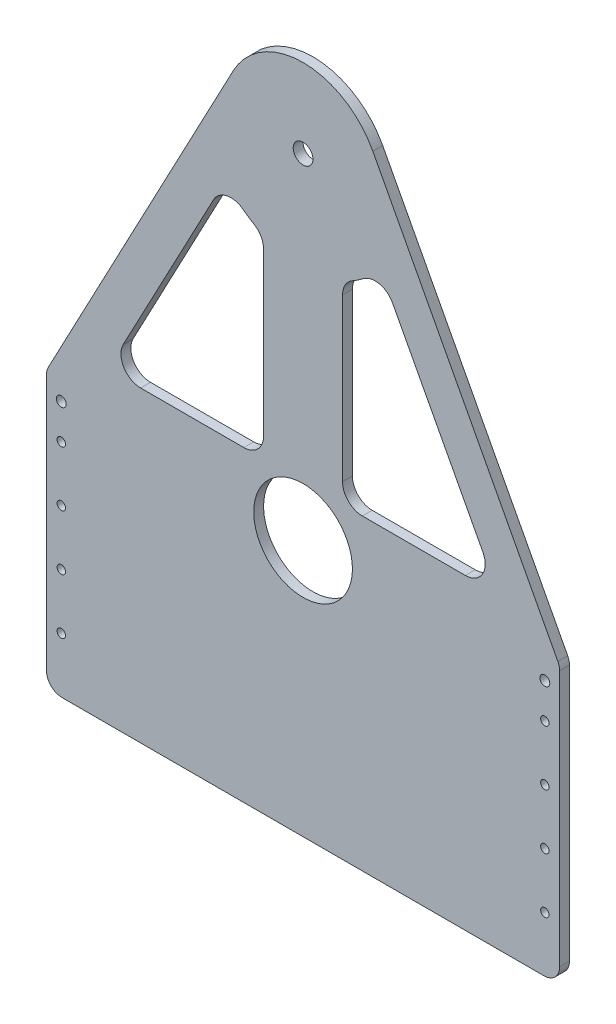
from build123d import *

# Parameters (mm, degrees)
AM_1014_TI_PLATE_BOTTOM_1_AM_0001_ARTEME_START = -3.175
AM_1014_TI_PLATE_BOTTOM_1_AM_0001_AR_2_R       = 1.352550752
AM_1014_TI_PLATE_BOTTOM_1_AM_0001_AR_2_R_2     = 1.5875
AM_1014_TI_PLATE_BOTTOM_1_AM_0001_AR_2_R_3     = 3.175
AM_1014_TI_PLATE_BOTTOM_1_AM_0001_ARTEME_DEPTH = 3.175
BOSS_EXTRUDE1_DEPTH                            = 3.175
FILLET1_R                                      = 5
FILLET2_R                                      = 5
SKETCH3_R                                      = 15.875
CUT_EXTRUDE1_DEPTH                             = 215.437164916


# Read off the part's stored shape, not the designer's step: AM_1014_TI_PLATE_BOTTOM<1>@AM_0001_ARTEMECH
with BuildPart() as part:
    # AM_1014_TI_PLATE_BOTTOM_1_AM_0001_AR 2 → AM_1014_TI_PLATE_BOTTOM<1>@AM_0001_ARTEMECH (new body)
    with BuildSketch(Plane.XY.offset(AM_1014_TI_PLATE_BOTTOM_1_AM_0001_ARTEME_START)):
        with BuildLine():
            Line((82.55, -17.865698052), (82.55, 70.885609673))
            Line((82.55, 70.885609673), (22.446426721, 184.373331383))
            ThreePointArc((22.446426721, 184.373331383), (0, 197.885609673), (-22.446426721, 184.373331383))
            Line((-22.446426721, 184.373331383), (-82.55, 70.885609673))
            Line((-82.55, 70.885609673), (-82.55, -17.865526365))
            Line((-82.55, -17.865526365), (82.55, -17.865698052))
        make_face()
        with BuildLine():
            add(Edge.make_bspline(
                [(-76.43495, -0.065424583), (-76.43495, -2.408108601), (-78.463775, -1.236766592), (-80.4926, -0.065424583), (-78.463775, 1.105917426), (-76.43495, 2.277259435), (-76.43495, -0.065424583)],
                knots=[0, 0, 0, 2.094395102, 2.094395102, 4.188790205, 4.188790205, 6.283185307, 6.283185307, 6.283185307], degree=2, weights=[1, 0.5, 1, 0.5, 1, 0.5, 1]))
        make_face(mode=Mode.SUBTRACT)
        with Locations((-77.7875, 17.727628115)):
            Circle(AM_1014_TI_PLATE_BOTTOM_1_AM_0001_AR_2_R, mode=Mode.SUBTRACT)
        with Locations((-77.7875, 35.507637995)):
            Circle(AM_1014_TI_PLATE_BOTTOM_1_AM_0001_AR_2_R, mode=Mode.SUBTRACT)
        with BuildLine():
            add(Edge.make_bspline(
                [(-76.43495, 53.274545779), (-76.43495, 50.931861761), (-78.463775, 52.10320377), (-80.4926, 53.274545779), (-78.463775, 54.445887788), (-76.43495, 55.617229797), (-76.43495, 53.274545779)],
                knots=[0, 0, 0, 2.094395102, 2.094395102, 4.188790205, 4.188790205, 6.283185307, 6.283185307, 6.283185307], degree=2, weights=[1, 0.5, 1, 0.5, 1, 0.5, 1]))
        make_face(mode=Mode.SUBTRACT)
        with Locations((-77.7875, 64.535609673)):
            Circle(AM_1014_TI_PLATE_BOTTOM_1_AM_0001_AR_2_R_2, mode=Mode.SUBTRACT)
        with BuildLine():
            Line((-25.498963051, 42.455971326), (-25.498963051, 51.980966033))
            add(Edge.make_bspline(
                [(-27.992064204, 57.025448466), (-25.498963051, 55.119281003), (-25.498963051, 51.980966033)],
                knots=[5.365154464, 5.365154464, 5.365154464, 6.283185307, 6.283185307, 6.283185307], degree=2, weights=[1, 0.896489165, 1]))
            ThreePointArc((-27.992064204, 57.025448466), (-26.013795844, 54.758623994), (-25.301036949, 51.835609673))
            Line((-25.301036949, 51.835609673), (-25.301036949, 42.310609673))
            ThreePointArc((-25.301036949, 42.310609673), (-24.985888452, 40.931525054), (-24.103005841, 39.826214575))
            add(Edge.make_bspline(
                [(-25.498963051, 42.455971326), (-25.49896305, 40.770584495), (-24.103005841, 39.826214575)],
                knots=[0, 0, 0, 0.976013915, 0.976013915, 0.976013915], degree=2, weights=[1, 0.883269083, 1]))
        make_face(mode=Mode.SUBTRACT)
        with Locations((-21.166666667, 47.762966307)):
            Circle(AM_1014_TI_PLATE_BOTTOM_1_AM_0001_AR_2_R_2, mode=Mode.SUBTRACT)
        with BuildLine():
            ThreePointArc((-11.2, 77.174125728), (-9.5, 78.874125728), (-7.8, 77.174125728))
            Line((-7.8, 77.174125728), (-7.8, 64.474125728))
            ThreePointArc((-7.8, 64.474125728), (-9.5, 62.774125728), (-11.2, 64.474125728))
            Line((-11.2, 64.474125728), (-11.2, 77.174125728))
        make_face(mode=Mode.SUBTRACT)
        with BuildLine():
            ThreePointArc((-1.7, 85.174125728), (0, 86.874125728), (1.7, 85.174125728))
            Line((1.7, 85.174125728), (1.7, 56.474125728))
            ThreePointArc((1.7, 56.474125728), (0, 54.774125728), (-1.7, 56.474125728))
            Line((-1.7, 56.474125728), (-1.7, 85.174125728))
        make_face(mode=Mode.SUBTRACT)
        with BuildLine():
            add(Edge.make_bspline(
                [(79.14005, -0.065596271), (79.14005, -2.408280289), (77.111225, -1.23693828), (75.0824, -0.065596271), (77.111225, 1.105745738), (79.14005, 2.277087747), (79.14005, -0.065596271)],
                knots=[0, 0, 0, 2.094395102, 2.094395102, 4.188790205, 4.188790205, 6.283185307, 6.283185307, 6.283185307], degree=2, weights=[1, 0.5, 1, 0.5, 1, 0.5, 1]))
        make_face(mode=Mode.SUBTRACT)
        with Locations((77.7875, 17.727456427)):
            Circle(AM_1014_TI_PLATE_BOTTOM_1_AM_0001_AR_2_R, mode=Mode.SUBTRACT)
        with Locations((77.7875, 35.507466307)):
            Circle(AM_1014_TI_PLATE_BOTTOM_1_AM_0001_AR_2_R, mode=Mode.SUBTRACT)
        with Locations((21.166666667, 47.762966307)):
            Circle(AM_1014_TI_PLATE_BOTTOM_1_AM_0001_AR_2_R_2, mode=Mode.SUBTRACT)
        with BuildLine():
            ThreePointArc((7.8, 77.174125728), (9.5, 78.874125728), (11.2, 77.174125728))
            Line((11.2, 77.174125728), (11.2, 64.474125728))
            ThreePointArc((11.2, 64.474125728), (9.5, 62.774125728), (7.8, 64.474125728))
            Line((7.8, 64.474125728), (7.8, 77.174125728))
        make_face(mode=Mode.SUBTRACT)
        with Locations((77.7875, 53.287476186)):
            Circle(AM_1014_TI_PLATE_BOTTOM_1_AM_0001_AR_2_R, mode=Mode.SUBTRACT)
        with Locations((77.7875, 64.535609673)):
            Circle(AM_1014_TI_PLATE_BOTTOM_1_AM_0001_AR_2_R_2, mode=Mode.SUBTRACT)
        with BuildLine():
            ThreePointArc((-28.80539088, 145.230757697), (-24.546211379, 148.463135508), (-19.3281535, 147.296624336))
            ThreePointArc((-19.3281535, 147.296624336), (-17.639343437, 146.086441824), (-15.875, 144.989303103))
            ThreePointArc((-15.875, 144.989303103), (-13.550738686, 142.665041789), (-12.7, 139.490041789))
            Line((-12.7, 139.490041789), (-12.7, 87.395609673))
            ThreePointArc((-12.7, 87.395609673), (-14.559871939, 82.905481612), (-19.05, 81.045609673))
            Line((-19.05, 81.045609673), (-52.249574284, 81.045609673))
            ThreePointArc((-52.249574284, 81.045609673), (-57.689898641, 84.120648468), (-57.861180964, 90.3675401))
            Line((-57.861180964, 90.3675401), (-28.80539088, 145.230757697))
        make_face(mode=Mode.SUBTRACT)
        with Locations((0, 172.485609673)):
            Circle(AM_1014_TI_PLATE_BOTTOM_1_AM_0001_AR_2_R_3, mode=Mode.SUBTRACT)
        with BuildLine():
            ThreePointArc((12.7, 139.490041789), (13.550738686, 142.665041789), (15.875, 144.989303103))
            ThreePointArc((15.875, 144.989303103), (17.639343437, 146.086441824), (19.3281535, 147.296624336))
            ThreePointArc((19.3281535, 147.296624336), (24.546211379, 148.463135508), (28.80539088, 145.230757697))
            Line((28.80539088, 145.230757697), (57.861180964, 90.3675401))
            ThreePointArc((57.861180964, 90.3675401), (57.689898641, 84.120648468), (52.249574284, 81.045609673))
            Line((52.249574284, 81.045609673), (19.05, 81.045609673))
            ThreePointArc((19.05, 81.045609673), (14.559871939, 82.905481612), (12.7, 87.395609673))
            Line((12.7, 87.395609673), (12.7, 139.490041789))
        make_face(mode=Mode.SUBTRACT)
    extrude(amount=AM_1014_TI_PLATE_BOTTOM_1_AM_0001_ARTEME_DEPTH)

    # Sketch2 → Boss-Extrude1 (add)
    with BuildSketch(Plane.XY):
        Polygon((-32.469776479, 59.073916865), (-26.167336903, 34.866819401), (-21.798600378, 37.659946031), (-22.638250573, 40.884966099), (-23.982968641, 44.105622871), (-23.310609607, 52.84309592), (-24.42605214, 57.127409286), (-28.115838313, 59.292776758), align=None)
        Polygon((-6.053335336, 87.881784973), (-14.736690513, 77.155287401), (-14.736690513, 57.127409286), (-2.605532544, 48.423597474), (16.810044844, 51.617454016), (16.810044844, 65.151825831), (13.228821015, 78.943036996), (9.014839826, 83.667803784), (0, 90.965531262), align=None)
        Polygon((-21.42787696, 50.494433374), (-22.918845174, 48.423597474), (-22.918845174, 45.648786681), (-20.375616181, 43.817703114), (14.824315675, 42.266139704), (26.595333202, 42.266139704), (26.595333202, 48.423597474), (23.719107345, 50.494433374), (18.474028772, 49.64052578), (-6.053335336, 47.698917024), align=None)
    extrude(amount=-BOSS_EXTRUDE1_DEPTH)

    # Fillet1
    fillet1_edges = [part.edges().sort_by_distance(p)[0] for p in [
        (-82.55, -17.865526365, -1.5875),
        (82.55, -17.865698052, -1.5875),
    ]]
    fillet(fillet1_edges, radius=FILLET1_R)

    # Fillet2
    fillet2_edges = [part.edges().sort_by_distance(p)[0] for p in [
        (82.55, 70.885609673, -1.5875),
        (-82.55, 70.885609673, -1.5875),
    ]]
    fillet(fillet2_edges, radius=FILLET2_R)

    # Sketch3 → Cut-Extrude1 (cut, through all)
    with BuildSketch(Plane(origin=(0, 0, -3.175), x_dir=(-1, 0, 0), z_dir=(0, 0, -1))):
        with Locations(Location((6.469e-06, 64.684387792, 0), (0, 0, 90))):
            Circle(SKETCH3_R)
    extrude(amount=-CUT_EXTRUDE1_DEPTH, mode=Mode.SUBTRACT)


solid = part.part
